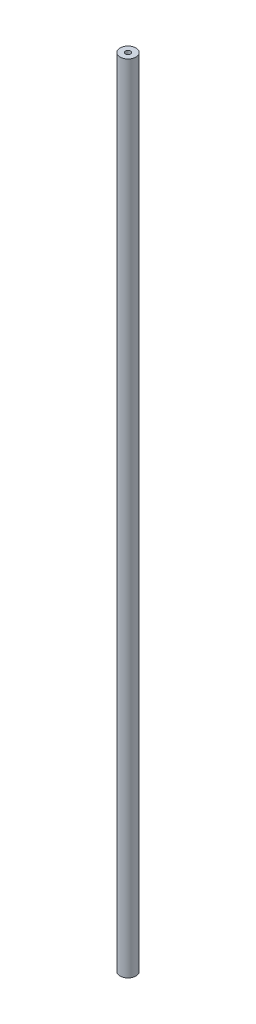
from build123d import *

# Parameters (mm, degrees)
SKETCH1_R                  = 6.35
BOSS_EXTRUDE1_DEPTH        = 635
F_10_32_TAPPED_HOLE1_D     = 4.0386
F_10_32_TAPPED_HOLE1_DEPTH = 12.02944
F_10_32_TAPPED_HOLE1_TIP   = 1.213317848
F_10_32_TAPPED_HOLE2_D     = 4.0386
F_10_32_TAPPED_HOLE2_DEPTH = 12.02944
F_10_32_TAPPED_HOLE2_TIP   = 1.213317848


with BuildPart() as part:
    # Sketch1 → Boss-Extrude1 (new body)
    with BuildSketch(Plane(origin=(0, 0, 0), x_dir=(1, 0, 0), z_dir=(0, 1, 0))):
        Circle(SKETCH1_R)
    extrude(amount=BOSS_EXTRUDE1_DEPTH)

    # #10-32 Tapped Hole1
    with Locations(Plane(origin=(0, 0, 0), x_dir=(-1, 0, 0), z_dir=(0, -1, 0))):
        with Locations((0, 0)):
            Hole(F_10_32_TAPPED_HOLE1_D / 2, depth=F_10_32_TAPPED_HOLE1_DEPTH)
            with Locations((0, 0, -(F_10_32_TAPPED_HOLE1_DEPTH + F_10_32_TAPPED_HOLE1_TIP / 2))):  # 118° drill point
                Cone(0, F_10_32_TAPPED_HOLE1_D / 2, F_10_32_TAPPED_HOLE1_TIP, mode=Mode.SUBTRACT)

    # #10-32 Tapped Hole2
    with Locations(Plane(origin=(0, 635, 0), x_dir=(1, 0, 0), z_dir=(0, 1, 0))):
        with Locations((0, 0)):
            Hole(F_10_32_TAPPED_HOLE2_D / 2, depth=F_10_32_TAPPED_HOLE2_DEPTH)
            with Locations((0, 0, -(F_10_32_TAPPED_HOLE2_DEPTH + F_10_32_TAPPED_HOLE2_TIP / 2))):  # 118° drill point
                Cone(0, F_10_32_TAPPED_HOLE2_D / 2, F_10_32_TAPPED_HOLE2_TIP, mode=Mode.SUBTRACT)


solid = part.part
